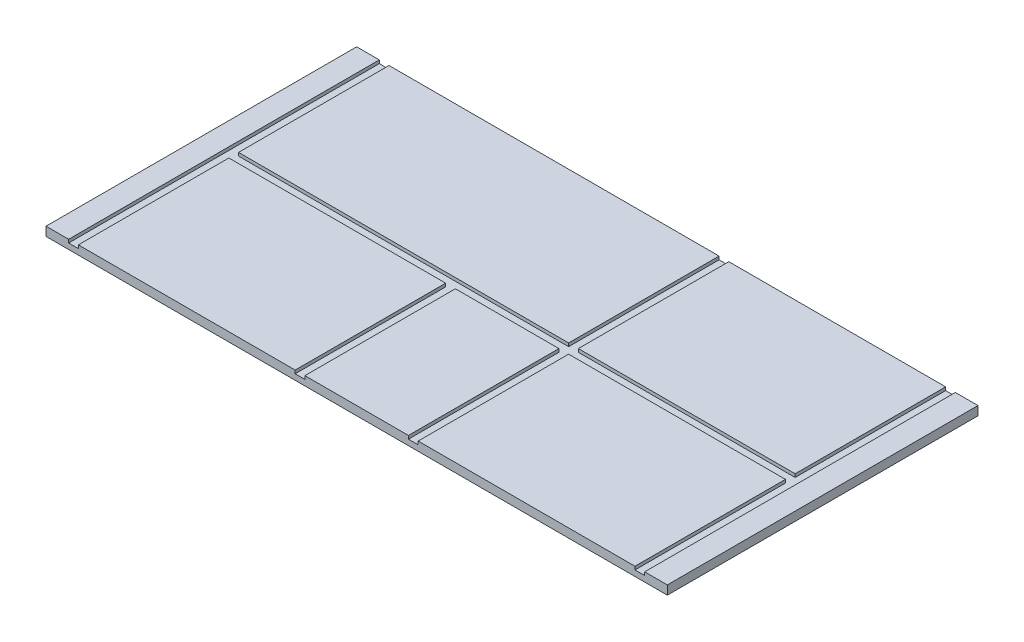
from build123d import *

# Parameters (mm, degrees)
SKETCH1_W           = 1219.2
SKETCH1_H           = 609.6
BOSS_EXTRUDE1_DEPTH = 17.4752
CUT_EXTRUDE1_DEPTH  = 6.35


with BuildPart() as part:
    # Sketch1 → Boss-Extrude1 (new body)
    with BuildSketch(Plane(origin=(0, 0, 0), x_dir=(1, 0, 0), z_dir=(0, 1, 0))):
        Rectangle(SKETCH1_W, SKETCH1_H)
    extrude(amount=BOSS_EXTRUDE1_DEPTH)

    # Sketch2 → Cut-Extrude1 (cut)
    with BuildSketch(Plane(origin=(0, 17.4752, 0), x_dir=(1, 0, 0), z_dir=(0, 1, 0))):
        Polygon((-565.15, 304.8), (-546.1, 304.8), (-546.1, 9.525), (101.6, 9.525), (101.6, 304.8), (120.65, 304.8), (120.65, 9.525), (546.1, 9.525), (546.1, 304.8), (565.15, 304.8), (565.15, -304.8), (546.1, -304.8), (546.1, -9.525), (120.65, -9.525), (120.65, -304.8), (101.6, -304.8), (101.6, -9.525), (-101.6, -9.525), (-101.6, -304.8), (-120.65, -304.8), (-120.65, -9.525), (-546.1, -9.525), (-546.1, -304.8), (-565.15, -304.8), align=None)
    extrude(amount=-CUT_EXTRUDE1_DEPTH, mode=Mode.SUBTRACT)


solid = part.part
